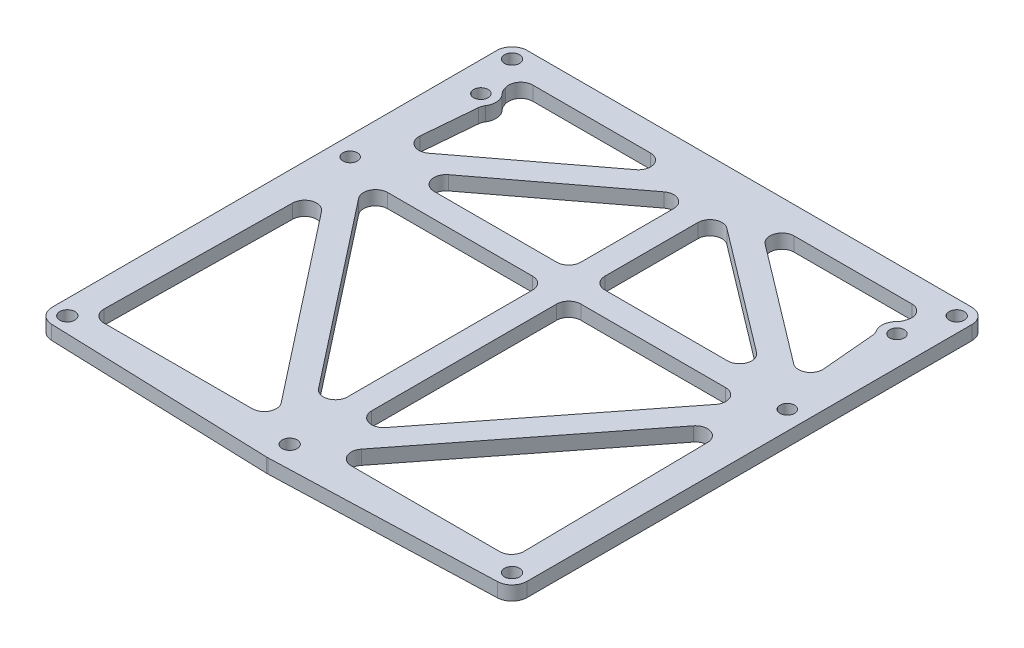
from build123d import *

# Parameters (mm, degrees)
SKETCH2_R           = 1.5875
SKETCH2_R_2         = 1.524
BOSS_EXTRUDE2_DEPTH = 2.9718
CUT_EXTRUDE1_DEPTH  = 72.903419609
FILLET1_R           = 2.54


with BuildPart() as part:
    # Sketch2 → Boss-Extrude2 (new body)
    with BuildSketch(Plane(origin=(0, 0, 0), x_dir=(1, 0, 0), z_dir=(0, 1, 0))):
        with BuildLine():
            Line((-46.932641484, -49.9981748), (-0.161462226, -51.5847622))
            ThreePointArc((-0.161462226, -51.5847622), (0, -51.5875), (0.161462226, -51.5847622))
            Line((0.161462226, -51.5847622), (46.932641484, -49.9981748))
            ThreePointArc((46.932641484, -49.9981748), (49.107803837, -49.031678872), (50, -46.825))
            Line((50, -46.825), (50, 46.825))
            ThreePointArc((50, 46.825), (49.07006403, 49.07006403), (46.825, 50))
            Line((46.825, 50), (-46.825, 50))
            ThreePointArc((-46.825, 50), (-49.07006403, 49.07006403), (-50, 46.825))
            Line((-50, 46.825), (-50, -46.825))
            ThreePointArc((-50, -46.825), (-49.107803837, -49.031678872), (-46.932641484, -49.9981748))
        make_face()
        with Locations((0, -46.825)):
            Circle(SKETCH2_R, mode=Mode.SUBTRACT)
        with Locations((-46.825, -46.825)):
            Circle(SKETCH2_R, mode=Mode.SUBTRACT)
        with Locations((-46.825, 46.825)):
            Circle(SKETCH2_R, mode=Mode.SUBTRACT)
        with Locations((46.825, 46.825)):
            Circle(SKETCH2_R, mode=Mode.SUBTRACT)
        with Locations((46.825, -46.825)):
            Circle(SKETCH2_R, mode=Mode.SUBTRACT)
        with Locations((-46.026877933, 11.948327334)):
            Circle(SKETCH2_R_2, mode=Mode.SUBTRACT)
        with Locations((-43.813122067, 37.251672666)):
            Circle(SKETCH2_R_2, mode=Mode.SUBTRACT)
        with Locations((46.026877933, 11.948327334)):
            Circle(SKETCH2_R_2, mode=Mode.SUBTRACT)
        with Locations((43.813122067, 37.251672666)):
            Circle(SKETCH2_R_2, mode=Mode.SUBTRACT)
    extrude(amount=BOSS_EXTRUDE2_DEPTH)

    # Sketch3 → Cut-Extrude1 (cut, through all)
    with BuildSketch(Plane(origin=(0, 0, 0), x_dir=(1, 0, 0), z_dir=(0, 1, 0))):
        with BuildLine():
            Line((43.363147562, 44.285), (7.557737131, 44.285))
            Line((7.557737131, 44.285), (42.997535117, 17.43064252))
            Line((42.997535117, 17.43064252), (41.448819224, 35.132546179))
            ThreePointArc((41.448819224, 35.132546179), (40.65688527, 37.596338128), (41.961912119, 39.831139031))
            Line((41.961912119, 39.831139031), (43.363147562, 44.285))
        make_face()
        with BuildLine():
            Line((-42.997535117, 17.43064252), (-7.557737131, 44.285))
            Line((-7.557737131, 44.285), (-43.363147562, 44.285))
            Line((-43.363147562, 44.285), (-41.961912119, 39.831139031))
            ThreePointArc((-41.961912119, 39.831139031), (-40.65688527, 37.596338128), (-41.448819224, 35.132546179))
            Line((-41.448819224, 35.132546179), (-42.997535117, 17.43064252))
        make_face()
        Polygon((38.469140802, 14.488327334), (2.54, 41.713482269), (2.54, 14.488327334), align=None)
        Polygon((-2.54, 14.488327334), (-2.54, 41.713482269), (-38.469140802, 14.488327334), align=None)
        Polygon((2.54, -39.461956848), (40.811554575, 9.408327334), (2.54, 9.408327334), align=None)
        Polygon((44.250273466, -44.285), (43.584931126, 4.710491728), (5.215323358, -44.285), align=None)
        Polygon((-5.215323358, -44.285), (-43.584931126, 4.710491728), (-44.250273466, -44.285), align=None)
        Polygon((-2.54, 9.408327334), (-40.811554575, 9.408327334), (-2.54, -39.461956848), align=None)
    extrude(amount=CUT_EXTRUDE1_DEPTH, mode=Mode.SUBTRACT)

    # Fillet1
    fillet1_edges = [part.edges().sort_by_distance(p)[0] for p in [
        (-5.215323358, 1.4859, 44.285),
        (-43.584931126, 1.4859, -4.710491728),
        (-44.250273466, 1.4859, 44.285),
        (43.584931126, 1.4859, -4.710491728),
        (5.215323358, 1.4859, 44.285),
        (44.250273466, 1.4859, 44.285),
        (2.54, 1.4859, -9.408327334),
        (2.54, 1.4859, 39.461956848),
        (40.811554575, 1.4859, -9.408327334),
        (-40.811554575, 1.4859, -9.408327334),
        (-2.54, 1.4859, 39.461956848),
        (-43.363147562, 1.4859, -44.285),
        (-41.961912119, 1.4859, -39.831139031),
        (41.961912119, 1.4859, -39.831139031),
        (43.363147562, 1.4859, -44.285),
        (-2.54, 1.4859, -9.408327334),
        (-2.54, 1.4859, -14.488327334),
        (-2.54, 1.4859, -41.713482269),
        (-38.469140802, 1.4859, -14.488327334),
        (38.469140802, 1.4859, -14.488327334),
        (2.54, 1.4859, -41.713482269),
        (2.54, 1.4859, -14.488327334),
        (-41.448819224, 1.4859, -35.132546179),
        (-42.997535117, 1.4859, -17.43064252),
        (-7.557737131, 1.4859, -44.285),
        (7.557737131, 1.4859, -44.285),
        (42.997535117, 1.4859, -17.43064252),
        (41.448819224, 1.4859, -35.132546179),
    ]]
    fillet(fillet1_edges, radius=FILLET1_R)


solid = part.part
